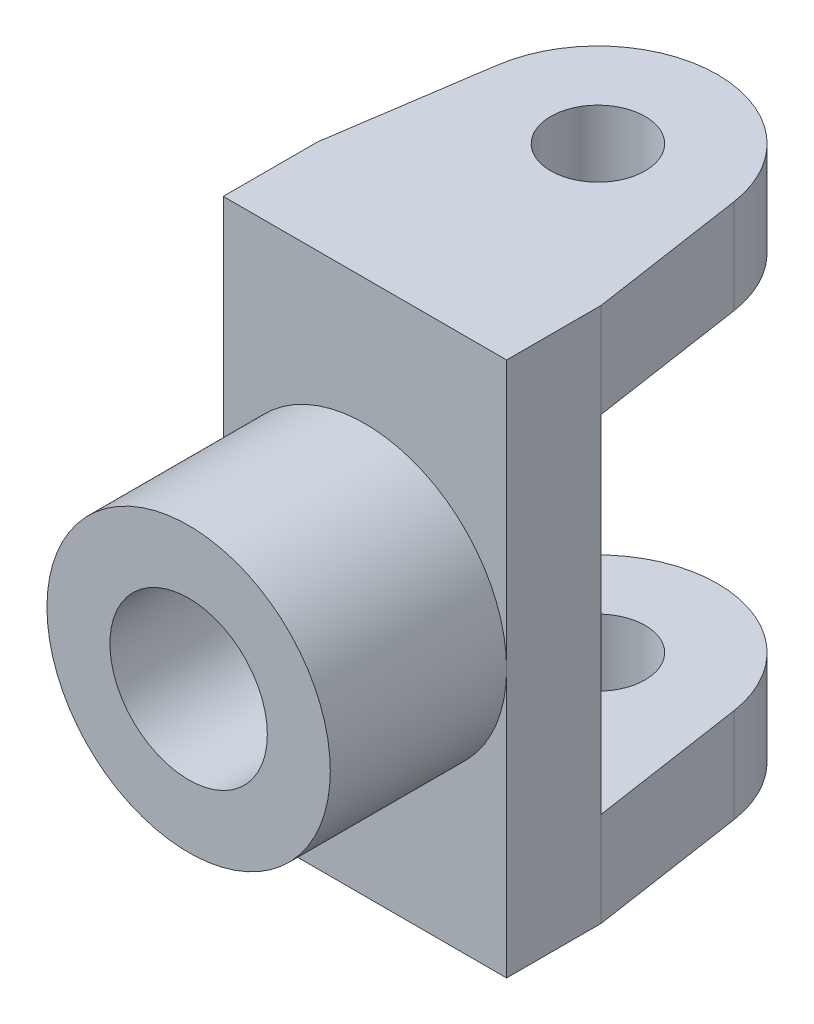
from build123d import *

# Parameters (mm, degrees)
SKETCH1_W               = 90
SKETCH1_H               = 170
BOSS_EXTRUDE1_DEPTH     = 30
SKETCH2_R               = 45
SKETCH2_R_2             = 25
BOSS_EXTRUDE2_DEPTH     = 56
BOSS_EXTRUDE3_START     = -30
BOSS_EXTRUDE3_OUTLINE_R = 15
BOSS_EXTRUDE3_DEPTH     = 30


# Read off the part's stored shape, not the designer's step: Boss-Extrude3
with BuildPart() as part:
    # Sketch1 → Boss-Extrude1 (new body)
    with BuildSketch(Plane.XY):
        Rectangle(SKETCH1_W, SKETCH1_H)
    extrude(amount=BOSS_EXTRUDE1_DEPTH)

    # Sketch2 → Boss-Extrude2 (add)
    with BuildSketch(Plane.XY.offset(30)):
        Circle(SKETCH2_R)
        Circle(SKETCH2_R_2, mode=Mode.SUBTRACT)
    extrude(amount=BOSS_EXTRUDE2_DEPTH)

    # Boss-Extrude3 outline → Boss-Extrude3 (add)
    with BuildSketch(Plane(origin=(0, 85, 0), x_dir=(1, 0, 0), z_dir=(0, 1, 0)).offset(BOSS_EXTRUDE3_START)):
        with BuildLine():
            Line((-45, 0), (45, 0))
            Line((45, 0), (37.582367692, 49.618330594))
            ThreePointArc((37.582367692, 49.618330594), (0, 82), (-37.582367692, 49.618330594))
            Line((-37.582367692, 49.618330594), (-45, 0))
        make_face()
        with Locations((0, 44)):
            Circle(BOSS_EXTRUDE3_OUTLINE_R, mode=Mode.SUBTRACT)
    boss_extrude3 = extrude(amount=BOSS_EXTRUDE3_DEPTH)

    # Mirror1: Boss-Extrude3 across plane
    add(boss_extrude3.mirror(Plane.ZX))


solid = part.part
